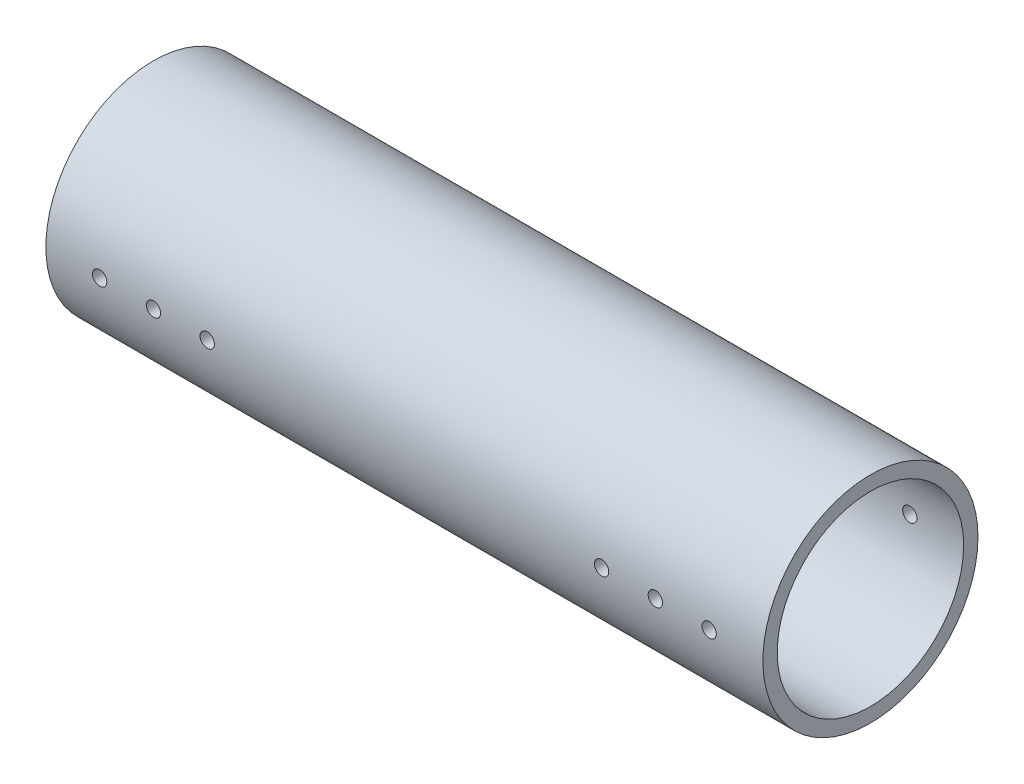
from build123d import *

# Parameters (mm, degrees)
SKETCH_2_R               = 30
SKETCH_2_R_2             = 26
EXTRUDE_2_DEPTH          = 200
CUT_EXTRUDE_2_DEPTH      = 10
CUT_EXTRUDE_2_DEPTH_BACK = 210.582919151
SKETCH_4_R               = 2


with BuildPart() as part:
    # Эскиз2 → Бобышка-Вытянуть2 (new body)
    with BuildSketch(Plane(origin=(0, 0, 0), x_dir=(0, 0, -1), z_dir=(1, 0, 0))):
        Circle(SKETCH_2_R)
        Circle(SKETCH_2_R_2, mode=Mode.SUBTRACT)
    extrude(amount=EXTRUDE_2_DEPTH)

    # Эскиз4 → Вырез-Вытянуть2 (cut, two sides: drawn at the far end of the back side and taken through both)
    with BuildSketch(Plane.XY.offset(25).offset(-CUT_EXTRUDE_2_DEPTH_BACK)):
        with Locations((15, 0)):
            Circle(SKETCH_4_R)
        with Locations((185, 0)):
            Circle(SKETCH_4_R)
        with Locations((30, 0)):
            Circle(SKETCH_4_R)
        with Locations((45, 0)):
            Circle(SKETCH_4_R)
        with Locations((170, 0)):
            Circle(SKETCH_4_R)
        with Locations((155, 0)):
            Circle(SKETCH_4_R)
    extrude(amount=CUT_EXTRUDE_2_DEPTH + CUT_EXTRUDE_2_DEPTH_BACK, mode=Mode.SUBTRACT)


solid = part.part
